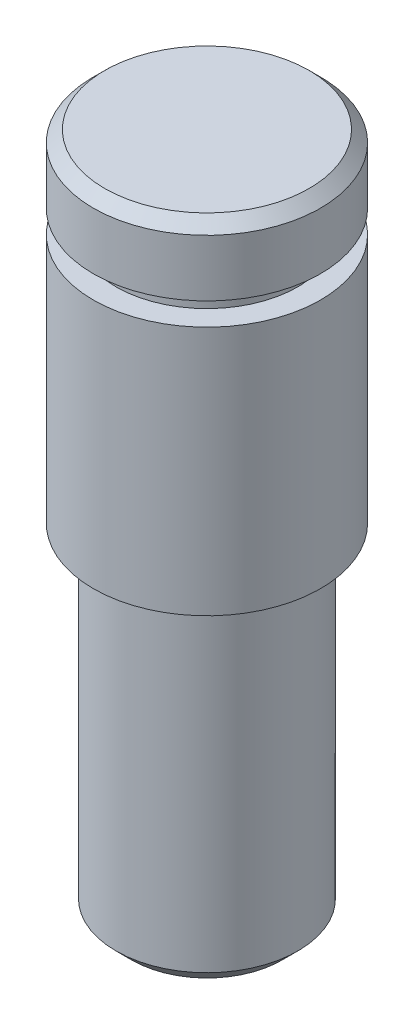
from build123d import *

# Parameters (mm, degrees)
SKETCH1_R           = 5
BOSS_EXTRUDE1_DEPTH = 30
CHAMFER1_SIZE       = 0.5
CUT_EXTRUDE1_START  = -3
SKETCH2_R           = 6
SKETCH2_R_2         = 4
CUT_EXTRUDE1_DEPTH  = 1


# Read off the part's stored shape, not the designer's step: M8 Machine Threads Stud1
with BuildPart() as part:
    # Sketch1 → Boss-Extrude1 (new body)
    with BuildSketch(Plane(origin=(0, 0, 0), x_dir=(1, 0, 0), z_dir=(0, 1, 0))):
        with Locations(Location((0, 0, 0), (0, 0, 270))):
            Circle(SKETCH1_R)
    extrude(amount=BOSS_EXTRUDE1_DEPTH)

    # Chamfer1
    chamfer1_edges = [part.edges().sort_by_distance(p)[0] for p in [
        (0, 30, -5),
    ]]
    chamfer(chamfer1_edges, length=CHAMFER1_SIZE)

    # Sketch2 → Cut-Extrude1 (cut)
    with BuildSketch(Plane(origin=(0, 30, 0), x_dir=(1, 0, 0), z_dir=(0, 1, 0)).offset(CUT_EXTRUDE1_START)):
        Circle(SKETCH2_R)
        with Locations(Location((0, 0, 0), (0, 0, 270))):
            Circle(SKETCH2_R_2, mode=Mode.SUBTRACT)
    extrude(amount=-CUT_EXTRUDE1_DEPTH, mode=Mode.SUBTRACT)

    # M8 Machine Threads Stud1 outline → M8 Machine Threads Stud1 (revolve, cut)
    with BuildSketch(Plane.XY):
        Polygon((3.3095, 0), (5, 0), (5, 15), (4, 15), (4, 0.6905), align=None)
    revolve(axis=Axis((0, 0, 0), (0, 1, 0)), mode=Mode.SUBTRACT)


solid = part.part
